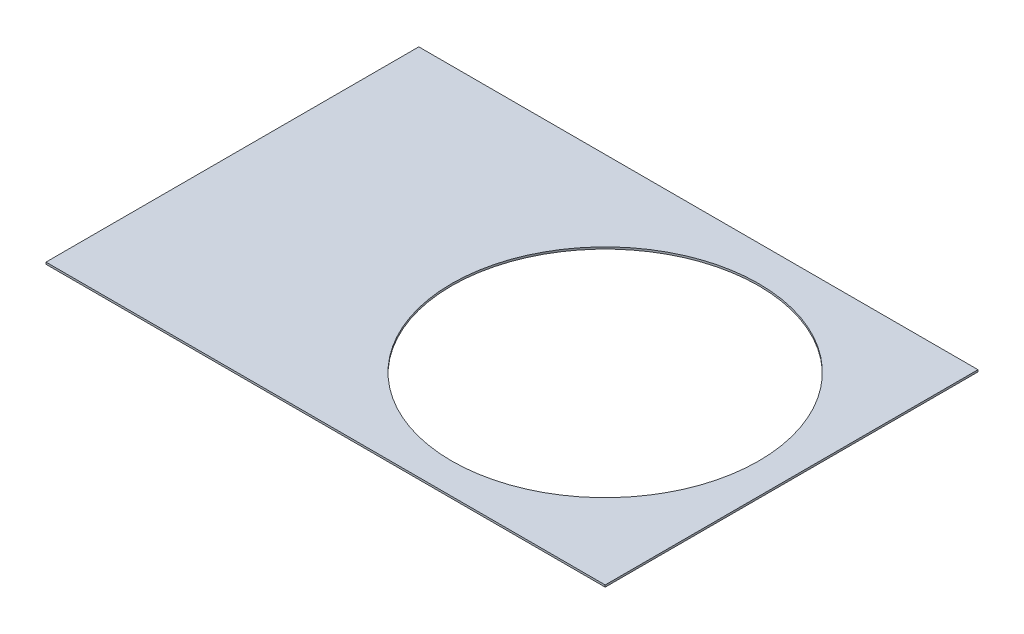
from build123d import *

# Parameters (mm, degrees)
SKETCH1_W           = 914.4
SKETCH1_H           = 609.6
SKETCH1_R           = 251.150820843
BOSS_EXTRUDE1_DEPTH = 3.175


with BuildPart() as part:
    # Sketch1 → Boss-Extrude1 (new body)
    with BuildSketch(Plane(origin=(0, 0, 0), x_dir=(1, 0, 0), z_dir=(0, 1, 0))):
        Rectangle(SKETCH1_W, SKETCH1_H)
        with Locations((156.049179157, -3.649179157)):
            Circle(SKETCH1_R, mode=Mode.SUBTRACT)
    extrude(amount=BOSS_EXTRUDE1_DEPTH)


solid = part.part
